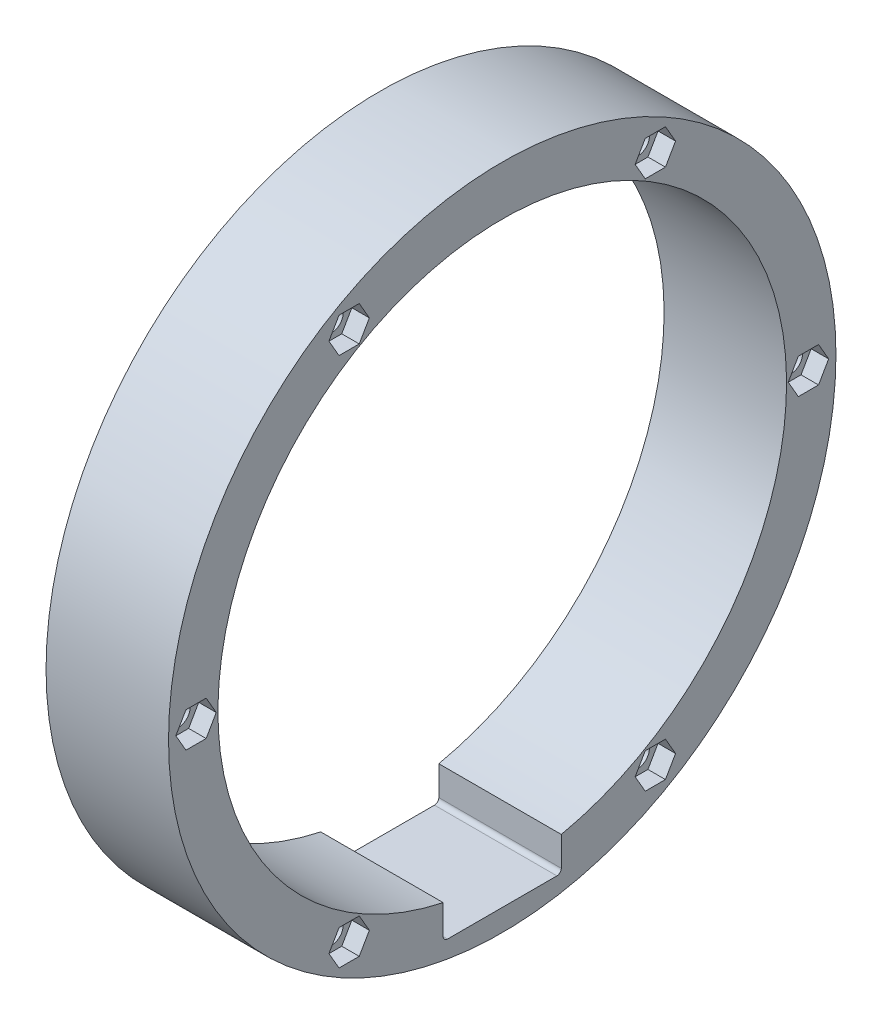
from build123d import *

# Parameters (mm, degrees)
SKETCH1_R           = 76.29
SKETCH1_R_2         = 65
BOSS_EXTRUDE1_DEPTH = 28
CUT_EXTRUDE1_REACH  = 113.464
CUT_EXTRUDE2_REACH  = 113.464
SKETCH3_R           = 2.65
CUT_EXTRUDE3_DEPTH  = 4


with BuildPart() as part:
    # Sketch1 → Boss-Extrude1 (new body)
    with BuildSketch(Plane(origin=(0, 0, 0), x_dir=(0, 0, -1), z_dir=(1, 0, 0))):
        Circle(SKETCH1_R)
        Circle(SKETCH1_R_2, mode=Mode.SUBTRACT)
    extrude(amount=BOSS_EXTRUDE1_DEPTH)

    # Sketch2 → Cut-Extrude1 (cut, up to next)
    with BuildSketch(Plane(origin=(28, 0, 0), x_dir=(0, 0, -1), z_dir=(1, 0, 0)), mode=Mode.PRIVATE) as cut_extrude1_sk1:
        with BuildLine():
            Line((-13.5, -51.893967527), (13.5, -51.893967527))
            Line((13.5, -51.893967527), (13.5, -70.29))
            ThreePointArc((13.5, -70.29), (13.207106781, -70.997106781), (12.5, -71.29))
            Line((12.5, -71.29), (-12.5, -71.29))
            ThreePointArc((-12.5, -71.29), (-13.207106781, -70.997106781), (-13.5, -70.29))
            Line((-13.5, -70.29), (-13.5, -51.893967527))
        make_face()
    cut_extrude1_tool1 = extrude(cut_extrude1_sk1.sketch, amount=-CUT_EXTRUDE1_REACH, mode=Mode.PRIVATE) & part.part
    add(cut_extrude1_tool1.solids().sort_by_distance((28, -61.584212, 0))[0], mode=Mode.SUBTRACT)

    # Sketch3 → Cut-Extrude2 (cut, up to next)
    with BuildSketch(Plane(origin=(28, 0, 0), x_dir=(0, 0, -1), z_dir=(1, 0, 0)), mode=Mode.PRIVATE) as cut_extrude2_sk1:
        with Locations((-70, 0)):
            Circle(SKETCH3_R)
    cut_extrude2_tool1 = extrude(cut_extrude2_sk1.sketch, amount=-CUT_EXTRUDE2_REACH, mode=Mode.PRIVATE) & part.part
    # Sketch3 → Cut-Extrude2 (cut, up to next)
    with BuildSketch(Plane(origin=(28, 0, 0), x_dir=(0, 0, -1), z_dir=(1, 0, 0)), mode=Mode.PRIVATE) as cut_extrude2_sk2:
        with Locations((-35, 60.621778265)):
            Circle(SKETCH3_R)
    cut_extrude2_tool2 = extrude(cut_extrude2_sk2.sketch, amount=-CUT_EXTRUDE2_REACH, mode=Mode.PRIVATE) & part.part
    # Sketch3 → Cut-Extrude2 (cut, up to next)
    with BuildSketch(Plane(origin=(28, 0, 0), x_dir=(0, 0, -1), z_dir=(1, 0, 0)), mode=Mode.PRIVATE) as cut_extrude2_sk3:
        with Locations((35, 60.621778265)):
            Circle(SKETCH3_R)
    cut_extrude2_tool3 = extrude(cut_extrude2_sk3.sketch, amount=-CUT_EXTRUDE2_REACH, mode=Mode.PRIVATE) & part.part
    # Sketch3 → Cut-Extrude2 (cut, up to next)
    with BuildSketch(Plane(origin=(28, 0, 0), x_dir=(0, 0, -1), z_dir=(1, 0, 0)), mode=Mode.PRIVATE) as cut_extrude2_sk4:
        with Locations((70, 0)):
            Circle(SKETCH3_R)
    cut_extrude2_tool4 = extrude(cut_extrude2_sk4.sketch, amount=-CUT_EXTRUDE2_REACH, mode=Mode.PRIVATE) & part.part
    # Sketch3 → Cut-Extrude2 (cut, up to next)
    with BuildSketch(Plane(origin=(28, 0, 0), x_dir=(0, 0, -1), z_dir=(1, 0, 0)), mode=Mode.PRIVATE) as cut_extrude2_sk5:
        with Locations((35, -60.621778265)):
            Circle(SKETCH3_R)
    cut_extrude2_tool5 = extrude(cut_extrude2_sk5.sketch, amount=-CUT_EXTRUDE2_REACH, mode=Mode.PRIVATE) & part.part
    # Sketch3 → Cut-Extrude2 (cut, up to next)
    with BuildSketch(Plane(origin=(28, 0, 0), x_dir=(0, 0, -1), z_dir=(1, 0, 0)), mode=Mode.PRIVATE) as cut_extrude2_sk6:
        with Locations((-35, -60.621778265)):
            Circle(SKETCH3_R)
    cut_extrude2_tool6 = extrude(cut_extrude2_sk6.sketch, amount=-CUT_EXTRUDE2_REACH, mode=Mode.PRIVATE) & part.part
    add(cut_extrude2_tool1.solids().sort_by_distance((28, 0, 70))[0], mode=Mode.SUBTRACT)
    add(cut_extrude2_tool2.solids().sort_by_distance((28, 60.621778, 35))[0], mode=Mode.SUBTRACT)
    add(cut_extrude2_tool3.solids().sort_by_distance((28, 60.621778, -35))[0], mode=Mode.SUBTRACT)
    add(cut_extrude2_tool4.solids().sort_by_distance((28, 0, -70))[0], mode=Mode.SUBTRACT)
    add(cut_extrude2_tool5.solids().sort_by_distance((28, -60.621778, -35))[0], mode=Mode.SUBTRACT)
    add(cut_extrude2_tool6.solids().sort_by_distance((28, -60.621778, 35))[0], mode=Mode.SUBTRACT)

    # Sketch4 → Cut-Extrude3 (cut)
    with BuildSketch(Plane(origin=(28, 0, 0), x_dir=(0, 0, -1), z_dir=(1, 0, 0))):
        Polygon((-37.309401077, 56.621778265), (-32.690598923, 56.621778265), (-30.381197846, 60.621778265), (-32.690598923, 64.621778265), (-37.309401077, 64.621778265), (-39.618802154, 60.621778265), align=None)
        Polygon((-67.690598923, -4), (-65.381197846, 0), (-67.690598923, 4), (-72.309401077, 4), (-74.618802154, 0), (-72.309401077, -4), align=None)
        Polygon((30.381197846, 60.621778265), (32.690598923, 56.621778265), (37.309401077, 56.621778265), (39.618802154, 60.621778265), (37.309401077, 64.621778265), (32.690598923, 64.621778265), align=None)
        Polygon((67.690598923, 4), (65.381197846, 0), (67.690598923, -4), (72.309401077, -4), (74.618802154, 0), (72.309401077, 4), align=None)
        Polygon((37.309401077, -56.621778265), (32.690598923, -56.621778265), (30.381197846, -60.621778265), (32.690598923, -64.621778265), (37.309401077, -64.621778265), (39.618802154, -60.621778265), align=None)
        Polygon((-30.381197846, -60.621778265), (-32.690598923, -56.621778265), (-37.309401077, -56.621778265), (-39.618802154, -60.621778265), (-37.309401077, -64.621778265), (-32.690598923, -64.621778265), align=None)
    extrude(amount=-CUT_EXTRUDE3_DEPTH, mode=Mode.SUBTRACT)


solid = part.part
